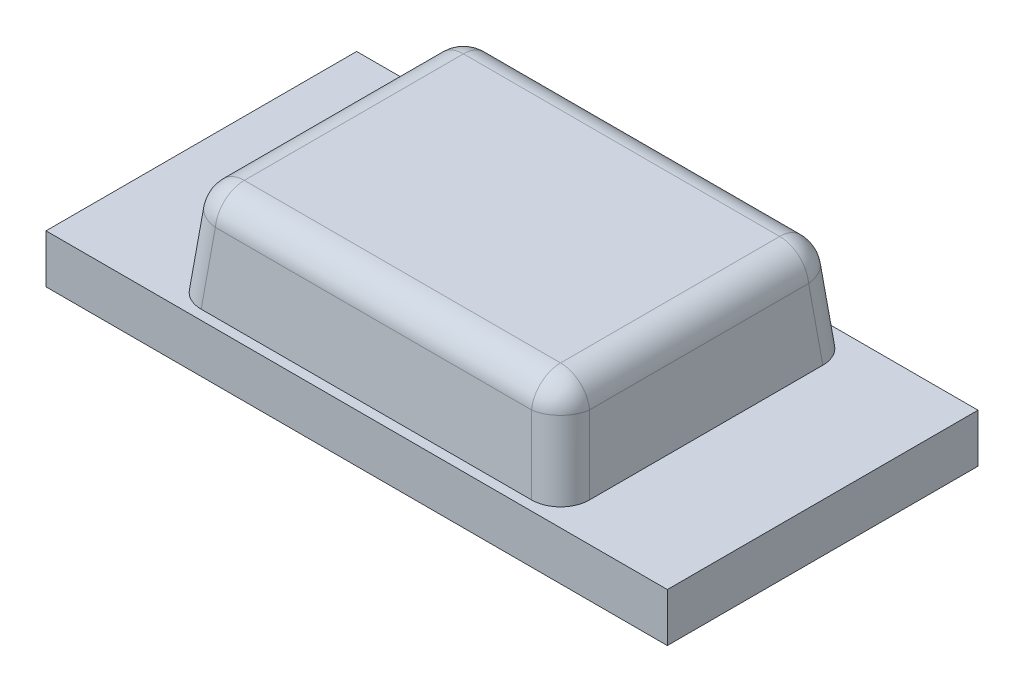
from build123d import *

# Parameters (mm, degrees)
SKETCH2_W           = 3.2
SKETCH2_H           = 1.6
BOSS_EXTRUDE1_DEPTH = 0.25
SKETCH4_W           = 2
SKETCH4_H           = 1.5
BOSS_EXTRUDE2_DEPTH = 0.5
BOSS_EXTRUDE2_TAPER = 5.71
FILLET1_R           = 0.15


with BuildPart() as part:
    # Sketch2 → Boss-Extrude1 (new body)
    with BuildSketch(Plane(origin=(0, 0, 0), x_dir=(1, 0, 0), z_dir=(0, 1, 0))):
        Rectangle(SKETCH2_W, SKETCH2_H)
    extrude(amount=BOSS_EXTRUDE1_DEPTH)

    # Sketch4 → Boss-Extrude2 (add)
    with BuildSketch(Plane(origin=(0, 0.25, 0), x_dir=(1, 0, 0), z_dir=(0, 1, 0))):
        Rectangle(SKETCH4_W, SKETCH4_H)
    extrude(amount=BOSS_EXTRUDE2_DEPTH, taper=BOSS_EXTRUDE2_TAPER)

    # Fillet1
    fillet1_edges = [part.edges().sort_by_distance(p)[0] for p in [
        (0, 0.75, 0.700005228),
        (-0.950005228, 0.75, 0),
        (0, 0.75, -0.700005228),
        (0.950005228, 0.75, 0),
        (-0.975002614, 0.5, -0.725002614),
        (0.975002614, 0.5, -0.725002614),
        (0.975002614, 0.5, 0.725002614),
        (-0.975002614, 0.5, 0.725002614),
    ]]
    fillet(fillet1_edges, radius=FILLET1_R)


solid = part.part
